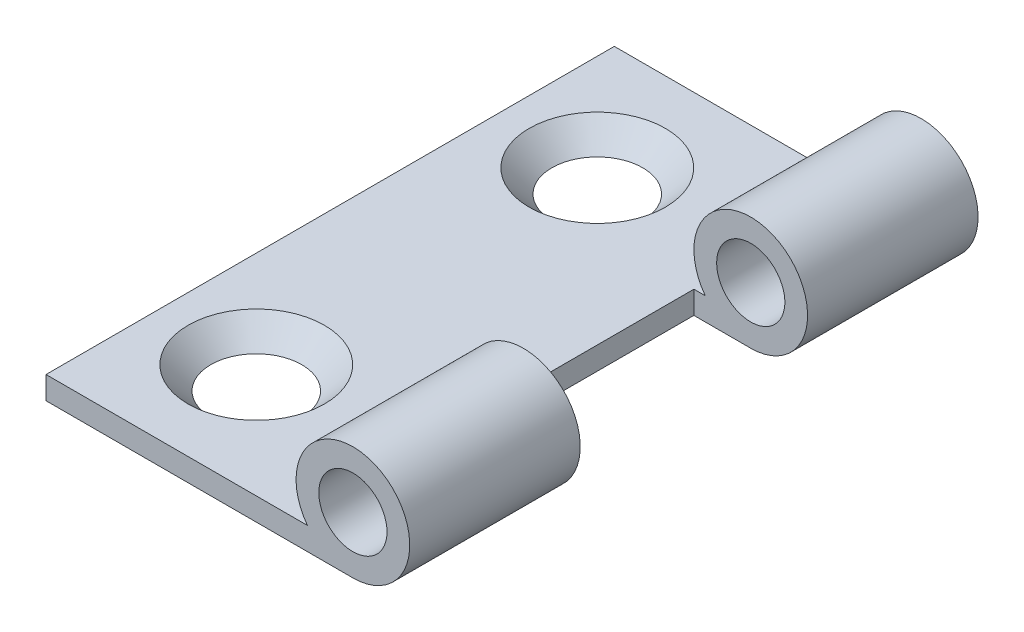
from build123d import *

# Parameters (mm, degrees)
SKETCH_1_R          = 1.5
EXTRUDE_1_DEPTH     = 25
SKETCH_2_R          = 2
SKETCH_2_W          = 5
SKETCH_2_H          = 10
CUT_EXTRUDE_1_DEPTH = 7.5
CHAMFER_1_SIZE      = 1


with BuildPart() as part:
    # 草图1 → 凸台-拉伸1 (new body)
    with BuildSketch(Plane.XY):
        with BuildLine():
            Line((0, -2.5), (-13.5, -2.5))
            Line((-13.5, -2.5), (-13.5, -1.5))
            Line((-13.5, -1.5), (-2, -1.5))
            ThreePointArc((-2, -1.5), (1.118033989, 2.236067977), (0, -2.5))
        make_face()
        Circle(SKETCH_1_R, mode=Mode.SUBTRACT)
    extrude(amount=EXTRUDE_1_DEPTH)

    # 草图2 → 切除-拉伸1 (cut, symmetric)
    with BuildSketch(Plane(origin=(0, -1.5, 0), x_dir=(1, 0, 0), z_dir=(0, 1, 0))):
        with Locations(Location((-9.25, -5, 0), (0, 0, 180))):
            Circle(SKETCH_2_R)
        with Locations(Location((-9.25, -20, 0), (0, 0, 180))):
            Circle(SKETCH_2_R)
        with Locations((0, -12.5)):
            Rectangle(SKETCH_2_W, SKETCH_2_H)
    extrude(amount=CUT_EXTRUDE_1_DEPTH, both=True, mode=Mode.SUBTRACT)

    # 倒角1
    chamfer_1_edges = [part.edges().sort_by_distance(p)[0] for p in [
        (-7.25, -1.5, 5),
        (-7.25, -1.5, 20),
    ]]
    chamfer(chamfer_1_edges, length=CHAMFER_1_SIZE - 0.0001)  # a hair under: the kernel refuses the full size


solid = part.part
